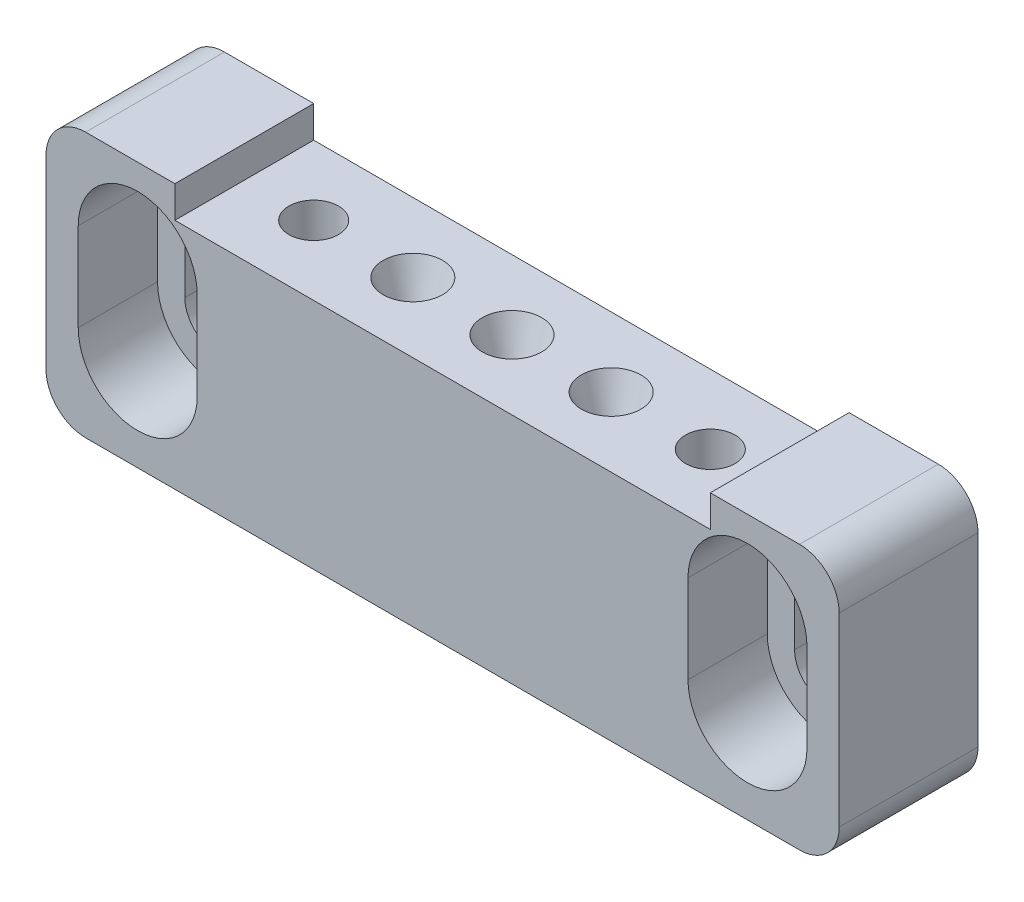
from build123d import *

# Parameters (mm, degrees)
BOSS_EXTRUDE1_DEPTH            = 7
SCREWHEADCLEARANCE_DEPTH       = 4
PCB_CUTOUT_DEPTH               = 30.03484975
SKETCH8_R                      = 1.25
SCREWTHREADS_DEPTH             = 16
SKETCH9_R                      = 3
CUT_EXTRUDE6_DEPTH             = 8.1
SKETCH10_W                     = 40
SKETCH10_H                     = 6.5
CUT_EXTRUDE7_DEPTH             = 30.034849842
FILLET1_R                      = 2
SKETCH11_R                     = 1.5
CLEARANCEHOLES_DEPTH           = 3
CLEARANCEHOLES_DRAFT           = -20
CLEARANCEHOLES_PROFILE_2_DEPTH = 3
CLEARANCEHOLES_PROFILE_2_DRAFT = -20
CLEARANCEHOLES_PROFILE_3_DEPTH = 3
CLEARANCEHOLES_PROFILE_3_DRAFT = -20


with BuildPart() as part:
    # Sketch1 → Boss-Extrude1 (new body)
    with BuildSketch(Plane.XY):
        with BuildLine():
            Line((0, 0), (18, 0))
            ThreePointArc((18, 0), (19.414213562, 0.585786438), (20, 2))
            Line((20, 2), (20, 11.945768163))
            ThreePointArc((20, 11.945768163), (19.769252649, 12.878369398), (19.130254936, 13.595775369))
            Line((19.130254936, 13.595775369), (10.510938386, 19.500007206))
            ThreePointArc((10.510938386, 19.500007206), (9.972285338, 19.760499203), (9.380683449, 19.85))
            Line((9.380683449, 19.85), (-9.380683449, 19.85))
            ThreePointArc((-9.380683449, 19.85), (-9.972285338, 19.760499203), (-10.510938386, 19.500007206))
            Line((-10.510938386, 19.500007206), (-19.130254936, 13.595775369))
            ThreePointArc((-19.130254936, 13.595775369), (-19.769252649, 12.878369398), (-20, 11.945768163))
            Line((-20, 11.945768163), (-20, 2))
            ThreePointArc((-20, 2), (-19.414213562, 0.585786438), (-18, 0))
            Line((-18, 0), (0, 0))
        make_face()
        with BuildLine():
            Line((-13.75, 9.075), (-13.75, 4.625))
            ThreePointArc((-13.75, 4.625), (-15.375, 3), (-17, 4.625))
            Line((-17, 4.625), (-17, 9.075))
            ThreePointArc((-17, 9.075), (-15.375, 10.7), (-13.75, 9.075))
        make_face(mode=Mode.SUBTRACT)
        with BuildLine():
            Line((17, 9.075), (17, 4.625))
            ThreePointArc((17, 4.625), (15.375, 3), (13.75, 4.625))
            Line((13.75, 4.625), (13.75, 9.075))
            ThreePointArc((13.75, 9.075), (15.375, 10.7), (17, 9.075))
        make_face(mode=Mode.SUBTRACT)
    extrude(amount=BOSS_EXTRUDE1_DEPTH)

    # Sketch2 → ScrewHeadClearance (cut)
    with BuildSketch(Plane.XY.offset(7)):
        with BuildLine():
            Line((-18.375, 4.625), (-18.375, 9.075))
            ThreePointArc((-18.375, 9.075), (-15.375, 12.075), (-12.375, 9.075))
            Line((-12.375, 9.075), (-12.375, 4.625))
            ThreePointArc((-12.375, 4.625), (-15.375, 1.625), (-18.375, 4.625))
        make_face()
        with BuildLine():
            Line((12.375, 4.625), (12.375, 9.075))
            ThreePointArc((12.375, 9.075), (15.375, 12.075), (18.375, 9.075))
            Line((18.375, 9.075), (18.375, 4.625))
            ThreePointArc((18.375, 4.625), (15.375, 1.625), (12.375, 4.625))
        make_face()
    extrude(amount=-SCREWHEADCLEARANCE_DEPTH, mode=Mode.SUBTRACT)

    # Sketch6 → PCB Cutout (cut, through all)
    with BuildSketch(Plane.XY.offset(7)):
        Polygon((-13.5, 13.35), (-6.5, 13.35), (-6.5, 19.85), (6.5, 19.85), (6.5, 13.35), (13.5, 13.35), (13.5, 11.75), (-13.5, 11.75), align=None)
    extrude(amount=-PCB_CUTOUT_DEPTH, mode=Mode.SUBTRACT)

    # Sketch8 → ScrewThreads (cut)
    with BuildSketch(Plane(origin=(0, 19.85, 0), x_dir=(1, 0, 0), z_dir=(0, 1, 0))):
        with Locations(Location((-10, -3.5, 0), (0, 0, 180))):
            Circle(SKETCH8_R)
        with Locations(Location((10, -3.5, 0), (0, 0, 180))):
            Circle(SKETCH8_R)
    extrude(amount=-SCREWTHREADS_DEPTH, mode=Mode.SUBTRACT)

    # Sketch9 → Cut-Extrude6 (cut)
    with BuildSketch(Plane(origin=(0, 19.85, 0), x_dir=(1, 0, 0), z_dir=(0, 1, 0))):
        with Locations(Location((10, -3.5, 0), (0, 0, 101.913740948))):
            Circle(SKETCH9_R)
        with Locations(Location((-10, -3.5, 0), (0, 0, 99.806006121))):
            Circle(SKETCH9_R)
    extrude(amount=-CUT_EXTRUDE6_DEPTH, mode=Mode.SUBTRACT)

    # Sketch10 → Cut-Extrude7 (cut, through all)
    with BuildSketch(Plane.XY.offset(7)):
        with Locations((0, 16.6)):
            Rectangle(SKETCH10_W, SKETCH10_H)
    extrude(amount=-CUT_EXTRUDE7_DEPTH, mode=Mode.SUBTRACT)

    # Fillet1
    # the kernel refuses this fillet: 2 mm, written as the material it takes off along each edge
    with BuildSketch(Plane(origin=(-19.424125327, 13.35, 12.203143064), x_dir=(-0.27669557885699486, -0.9609576247894558, 0), z_dir=(0, 0, -1))) as fillet1_piece_1:
        with BuildLine():
            CenterArc((1.527866068, -1.92191525), FILLET1_R, 73.936914891, 90)
            Line((-0.394049182, -1.368524092), (-0.586240707, -1.313184976))
            Line((-0.586240707, -1.313184976), (-0.192191525, 0.055339116))
            Line((-0.192191525, 0.055339116), (-0.095535811, 0.175706883))
            ThreePointArc((-0.095535811, 0.175706883), (1.564088383, 0.357037942), (2.136596341, 0.192191525))
            Line((2.136596341, 0.192191525), (2.081257226, 0))
        make_face()
    extrude(amount=17.406286128, mode=Mode.SUBTRACT)
    with BuildSketch(Plane(origin=(19.424125327, 13.35, 12.203143064), x_dir=(-1, 0, 0), z_dir=(0, 0, -1))) as fillet1_piece_2:
        with BuildLine():
            CenterArc((1.424125327, -2), FILLET1_R, 90, 90)
            Line((-0.575874673, -2), (-0.775874673, -2))
            ThreePointArc((-0.775874673, -2), (-0.775874673, -1.404231837), (-0.142412533, 0.140423184))
            Line((-0.142412533, 0.140423184), (0, 0.2))
            Line((0, 0.2), (1.424125327, 0.2))
            Line((1.424125327, 0.2), (1.424125327, 0))
        make_face()
    extrude(amount=17.406286128, mode=Mode.SUBTRACT)


with BuildPart() as clearanceholes_tool:
    # Sketch11 → ClearanceHoles (with draft: the straight prism first)
    with BuildSketch(Plane(origin=(0, 11.75, 0), x_dir=(1, 0, 0), z_dir=(0, 1, 0))):
        with Locations((0, -3.5)):
            Circle(SKETCH11_R)
    extrude(amount=-CLEARANCEHOLES_DEPTH)
    # ClearanceHoles: the draft: its side faces are tilted about the plane it starts from
    clearanceholes_sides = [clearanceholes_tool.faces().sort_by_distance(p)[0] for p in [
        (-1.5, 10.25, 3.5),
    ]]
    draft(clearanceholes_sides, Plane(origin=(0, 11.75, 0), x_dir=(1, 0, 0), z_dir=(0, 1, 0)), CLEARANCEHOLES_DRAFT)


with BuildPart() as part_1:
    add(part.part)

    # ClearanceHoles: cut by clearanceholes_tool
    add(clearanceholes_tool.part, mode=Mode.SUBTRACT)


with BuildPart() as clearanceholes_profile_2_tool:
    # Sketch11 → ClearanceHoles profile 2 (with draft: the straight prism first)
    with BuildSketch(Plane(origin=(0, 11.75, 0), x_dir=(1, 0, 0), z_dir=(0, 1, 0))):
        with Locations((5, -3.5)):
            Circle(SKETCH11_R)
    extrude(amount=-CLEARANCEHOLES_PROFILE_2_DEPTH)
    # ClearanceHoles profile 2: the draft: its side faces are tilted about the plane it starts from
    clearanceholes_profile_2_sides = [clearanceholes_profile_2_tool.faces().sort_by_distance(p)[0] for p in [
        (3.5, 10.25, 3.5),
    ]]
    draft(clearanceholes_profile_2_sides, Plane(origin=(0, 11.75, 0), x_dir=(1, 0, 0), z_dir=(0, 1, 0)), CLEARANCEHOLES_PROFILE_2_DRAFT)


with BuildPart() as part_2:
    add(part_1.part)

    # ClearanceHoles profile 2: cut by clearanceholes_profile_2_tool
    add(clearanceholes_profile_2_tool.part, mode=Mode.SUBTRACT)


with BuildPart() as clearanceholes_profile_3_tool:
    # Sketch11 → ClearanceHoles profile 3 (with draft: the straight prism first)
    with BuildSketch(Plane(origin=(0, 11.75, 0), x_dir=(1, 0, 0), z_dir=(0, 1, 0))):
        with Locations((-5, -3.5)):
            Circle(SKETCH11_R)
    extrude(amount=-CLEARANCEHOLES_PROFILE_3_DEPTH)
    # ClearanceHoles profile 3: the draft: its side faces are tilted about the plane it starts from
    clearanceholes_profile_3_sides = [clearanceholes_profile_3_tool.faces().sort_by_distance(p)[0] for p in [
        (-6.5, 10.25, 3.5),
    ]]
    draft(clearanceholes_profile_3_sides, Plane(origin=(0, 11.75, 0), x_dir=(1, 0, 0), z_dir=(0, 1, 0)), CLEARANCEHOLES_PROFILE_3_DRAFT)


with BuildPart() as part_3:
    add(part_2.part)

    # ClearanceHoles profile 3: cut by clearanceholes_profile_3_tool
    add(clearanceholes_profile_3_tool.part, mode=Mode.SUBTRACT)


solid = part_3.part
